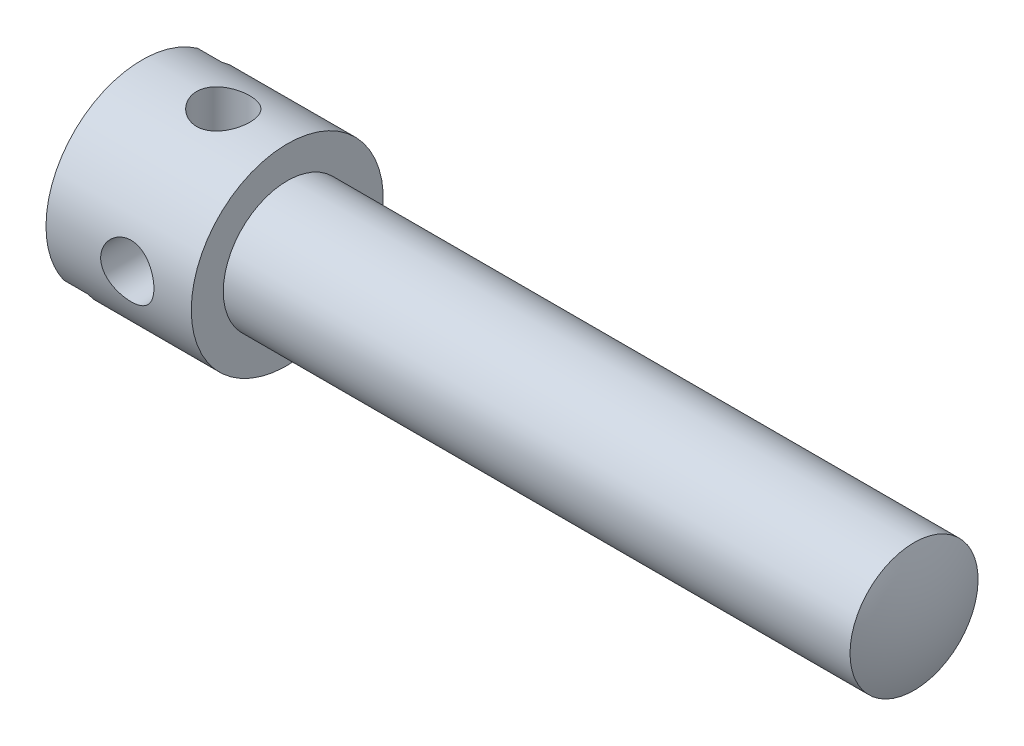
from build123d import *

# Parameters (mm, degrees)
SKETCH2_R          = 5
NECK_DEPTH         = 50
SKETCH5_R          = 2.08
CUT_EXTRUDE1_DEPTH = 70
SKETCH6_R          = 2.08
CUT_EXTRUDE2_DEPTH = 70
SKETCH7_W          = 3
SKETCH7_H          = 2.5
CUT_EXTRUDE3_DEPTH = 70


with BuildPart() as part:
    # Sketch1 → BaseHead (revolve)
    with BuildSketch(Plane.XY):
        with BuildLine():
            Line((1.151519965, 7.5), (12.5, 7.5))
            Line((12.5, 7.5), (12.5, 0))
            Line((12.5, 0), (0, 0))
            ThreePointArc((0, 0), (0.289556855, 3.793942482), (1.151519965, 7.5))
        make_face()
    revolve(axis=Axis((-25.059543495, 0, 0), (1, 0, 0)))

    # Sketch2 → Neck (add)
    with BuildSketch(Plane(origin=(12.5, 3.614329884, 0.195577912), x_dir=(0, 0, -1), z_dir=(1, 0, 0))):
        with Locations((0.195577912, -3.614329884)):
            Circle(SKETCH2_R)
    extrude(amount=NECK_DEPTH)

    # Sketch4 → Cut-Revolve1 (revolve, cut)
    with BuildSketch(Plane.XY):
        with BuildLine():
            Line((50, 12.5), (50, 17.5))
            Line((50, 17.5), (67.5, 17.5))
            Line((67.5, 17.5), (67.5, 0))
            Line((67.5, 0), (62.5, 0))
            ThreePointArc((62.5, 0), (58.838834765, 8.838834765), (50, 12.5))
        make_face()
    revolve(axis=Axis((61.414233577, 0, 0), (-1, 0, 0)), mode=Mode.SUBTRACT)

    # Sketch5 → Cut-Extrude1 (cut, symmetric)
    with BuildSketch(Plane.XY):
        with Locations((7.5, 0)):
            Circle(SKETCH5_R)
    extrude(amount=CUT_EXTRUDE1_DEPTH, both=True, mode=Mode.SUBTRACT)

    # Sketch6 → Cut-Extrude2 (cut, symmetric)
    with BuildSketch(Plane(origin=(0, 0, 0), x_dir=(1, 0, 0), z_dir=(0, 1, 0))):
        with Locations((7.5, 0)):
            Circle(SKETCH6_R)
    extrude(amount=CUT_EXTRUDE2_DEPTH, both=True, mode=Mode.SUBTRACT)

    # Sketch7 → Cut-Extrude3 (cut, symmetric)
    with BuildSketch(Plane(origin=(0, 0, 0), x_dir=(1, 0, 0), z_dir=(0, -0.7071067811865488, 0.7071067811865462))):
        with Locations((1.5, 0)):
            Rectangle(SKETCH7_W, SKETCH7_H)
    extrude(amount=CUT_EXTRUDE3_DEPTH, both=True, mode=Mode.SUBTRACT)


solid = part.part
